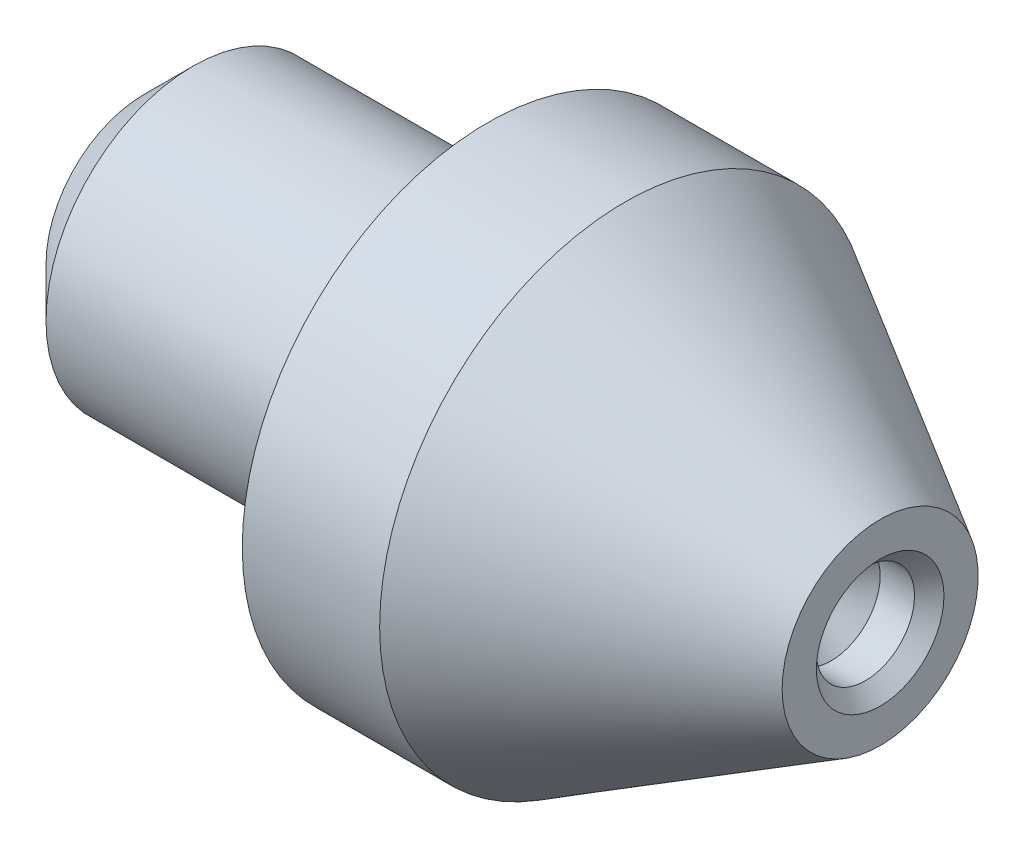
from build123d import *

# Parameters (mm, degrees)
SKETCH2_R          = 1
CUT_EXTRUDE1_DEPTH = 0.3
CHAMFER1_SIZE      = 0.3
SKETCH3_R          = 1
CUT_EXTRUDE2_DEPTH = 0.7


with BuildPart() as part:
    # Sketch1 → Revolve1 (revolve)
    with BuildSketch(Plane(origin=(0, 0, 0), x_dir=(1, 0, 0), z_dir=(0, 1, 0)), mode=Mode.PRIVATE) as revolve1_sk:
        Polygon((-7, 0), (-7, 2), (-6, 3), (0, 3), (0, 5), (2.8, 5), (8, 1.9977786), (8, 0), align=None)
    revolve(revolve1_sk.sketch.rotate(Axis((-2.427745665, 0, 0), (1, 0, 0)), 180), axis=Axis((-2.427745665, 0, 0), (1, 0, 0)))

    # Sketch2 → Cut-Extrude1 (cut)
    with BuildSketch(Plane(origin=(8, 0, 0), x_dir=(0, 0, -1), z_dir=(1, 0, 0))):
        Circle(SKETCH2_R)
    extrude(amount=-CUT_EXTRUDE1_DEPTH, mode=Mode.SUBTRACT)

    # Chamfer1
    chamfer1_edges = [part.edges().sort_by_distance(p)[0] for p in [
        (8, 0, 1),
    ]]
    chamfer(chamfer1_edges, length=CHAMFER1_SIZE - 0.0001)  # a hair under: the kernel refuses the full size

    # Sketch3 → Cut-Extrude2 (cut)
    with BuildSketch(Plane(origin=(7.7, 0, 0), x_dir=(0, 0, -1), z_dir=(1, 0, 0))):
        Circle(SKETCH3_R)
    extrude(amount=-CUT_EXTRUDE2_DEPTH, mode=Mode.SUBTRACT)

    # Cut-Extrude3 cone 1 section (through the dimple's axis) → Cut-Extrude3 (revolve, cut)
    with BuildSketch(Plane(origin=(7, 0, 0), x_dir=(0, 0, -1), z_dir=(0, 1, 0))):
        Polygon((0, 0), (1, 0), (0, 1), align=None)
    revolve(axis=Axis((7, 0, 0), (-1, 0, 0)), mode=Mode.SUBTRACT)


solid = part.part
